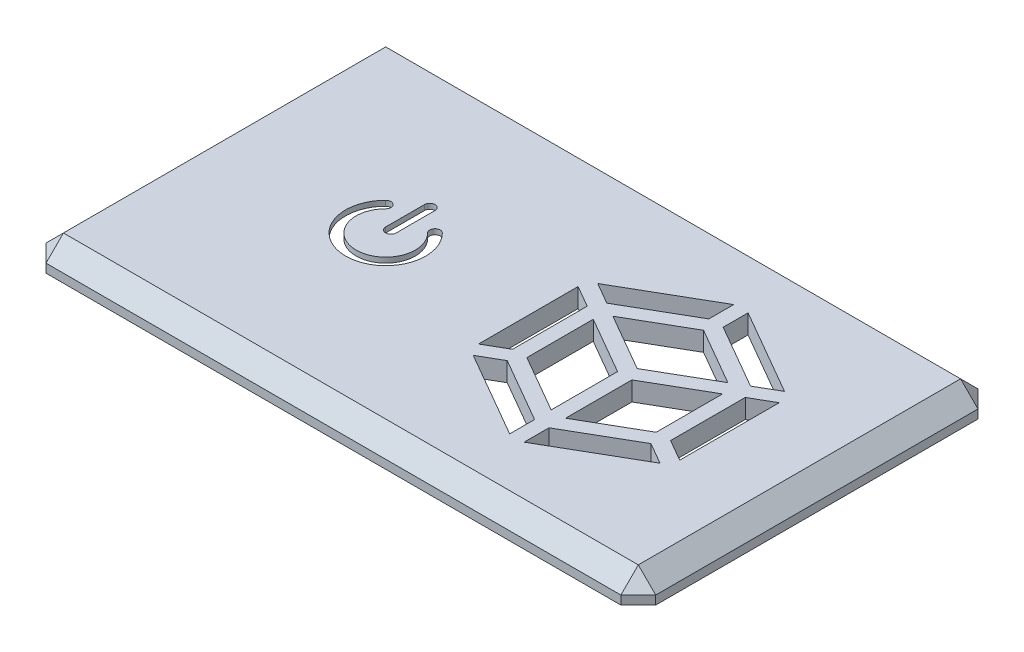
from build123d import *

# Parameters (mm, degrees)
ESQUISSE1_W             = 70
ESQUISSE1_H             = 41
BOSS_EXTRU_1_DEPTH      = 3
COQUE1_T                = -2.2
CHANFREIN1_SIZE         = 2
ESQUISSE3_W             = 20.2
ESQUISSE3_H             = 15.2
ENL_V_MAT_EXTRU_2_DEPTH = 1.6
ENL_V_MAT_EXTRU_5_DEPTH = 41.672472263
ENL_V_START             = -2.2
ENL_V_MAT_EXTRU_4_DEPTH = 2.2
ESQUISSE7_W             = 65.6
ESQUISSE7_H             = 36.6
ESQUISSE7_W_2           = 61.6
ESQUISSE7_H_2           = 32.6
EXTRU_MINCE1_DEPTH      = 2
CONG_1_R                = 1


# Read off the part's stored shape, not the designer's step: Enlèv. mat.-Extru.4
with BuildPart() as part:
    # Esquisse1 → Boss.-Extru.1 (new body)
    with BuildSketch(Plane(origin=(0, 0, 0), x_dir=(1, 0, 0), z_dir=(0, 1, 0))):
        Rectangle(ESQUISSE1_W, ESQUISSE1_H)
    extrude(amount=BOSS_EXTRU_1_DEPTH)

    # Coque1
    coque1_openings = [part.faces().sort_by_distance(p)[0] for p in [
        (0, 0, 0),
    ]]
    offset(amount=COQUE1_T, openings=coque1_openings, kind=Kind.INTERSECTION)

    # Chanfrein1
    chanfrein1_edges = [part.edges().sort_by_distance(p)[0] for p in [
        (-35, 3, 0),
        (0, 3, 20.5),
        (35, 3, 0),
        (35, 1.5, 20.5),
        (-35, 1.5, 20.5),
        (-35, 1.5, -20.5),
        (35, 1.5, -20.5),
        (0, 3, -20.5),
    ]]
    chamfer(chanfrein1_edges, length=CHANFREIN1_SIZE)

    # Esquisse3 → Enlèv. mat.-Extru.2 (cut)
    with BuildSketch(Plane.XZ.offset(-0.8)):
        with Locations((-17, 0)):
            Rectangle(ESQUISSE3_W, ESQUISSE3_H)
    extrude(amount=-ENL_V_MAT_EXTRU_2_DEPTH, mode=Mode.SUBTRACT)

    # Esquisse8 → Enlèv. mat.-Extru.5 (cut, through all)
    with BuildSketch(Plane(origin=(0, 3, 0), x_dir=(1, 0, 0), z_dir=(0, 1, 0))):
        with BuildLine():
            Line((-13.9, 5.056854249), (-13.9, 0.6))
            ThreePointArc((-13.9, 0.6), (-14.5, 0), (-15.1, 0.6))
            Line((-15.1, 0.6), (-15.1, 5.056854249))
            ThreePointArc((-15.1, 5.056854249), (-14.5, 5.656854249), (-13.9, 5.056854249))
        make_face()
        with BuildLine():
            ThreePointArc((-17.752691193, 3.252691193), (-14.5, -4.6), (-11.247308807, 3.252691193))
            ThreePointArc((-11.247308807, 3.252691193), (-12.095836944, 3.252691193), (-12.095836944, 2.404163056))
            ThreePointArc((-12.095836944, 2.404163056), (-14.5, -3.4), (-16.904163056, 2.404163056))
            ThreePointArc((-16.904163056, 2.404163056), (-16.904163056, 3.252691193), (-17.752691193, 3.252691193))
        make_face()
    extrude(amount=-ENL_V_MAT_EXTRU_5_DEPTH, mode=Mode.SUBTRACT)

    # Enlèv. mat.-Extru.4 outline → Enlèv. mat.-Extru.4 (cut)
    with BuildSketch(Plane(origin=(0, 3, 0), x_dir=(1, 0, 0), z_dir=(0, 1, 0)).offset(ENL_V_START)):
        Polygon((21.667594623, 5.714552033), (24.142355296, 7.1431654), (14.244110438, 12.858801818), (14.243939692, 10.001279345), align=None)
        Polygon((12.5925129, -0.475203574), (5.9935572, 3.335122269), (5.993101889, -4.284757181), (12.592057589, -8.095083023), align=None)
        Polygon((4.344642768, 4.288171287), (1.870052841, 5.717080393), (1.869369857, -5.7130095), (4.34413053, -4.284396133), align=None)
        Polygon((12.594164363, 10.001377924), (12.594335108, 12.858900397), (2.695407267, 7.144446922), (5.169997194, 5.715537816), align=None)
        Polygon((5.168559477, -5.714552033), (2.693798804, -7.1431654), (12.592043662, -12.858801818), (12.592214408, -10.001279345), align=None)
        Polygon((14.240438301, -8.095181519), (20.839849312, -4.28564432), (20.840304623, 3.33423513), (14.240893612, -0.47530207), align=None)
        Polygon((13.418138159, 0.954049774), (20.01754917, 4.763586973), (13.41859347, 8.573912816), (6.819182459, 4.764375617), align=None)
        Polygon((22.491511493, -4.285480495), (24.96610142, -5.714389602), (24.966784403, 5.715700292), (22.49202373, 4.287086925), align=None)
        Polygon((14.241989737, -10.001377924), (14.241818992, -12.858900397), (24.140746833, -7.144446922), (21.666156906, -5.715537816), align=None)
    extrude(amount=ENL_V_MAT_EXTRU_4_DEPTH, mode=Mode.SUBTRACT)

    # Esquisse7 → Extru.-Mince1 (add)
    with BuildSketch(Plane.XZ.offset(-0.8)):
        Rectangle(ESQUISSE7_W, ESQUISSE7_H)
        Rectangle(ESQUISSE7_W_2, ESQUISSE7_H_2, mode=Mode.SUBTRACT)
    extrude(amount=EXTRU_MINCE1_DEPTH)

    # Congé1
    cong_1_edges = [part.edges().sort_by_distance(p)[0] for p in [
        (-32.8, -0.6, -18.3),
        (32.8, -0.6, -18.3),
        (32.8, -0.6, 18.3),
        (-32.8, -0.6, 18.3),
        (0, 0.8, -16.3),
        (30.8, 0.8, 0),
        (0, 0.8, 16.3),
        (-30.8, 0.8, 0),
    ]]
    fillet(cong_1_edges, radius=CONG_1_R)


solid = part.part
